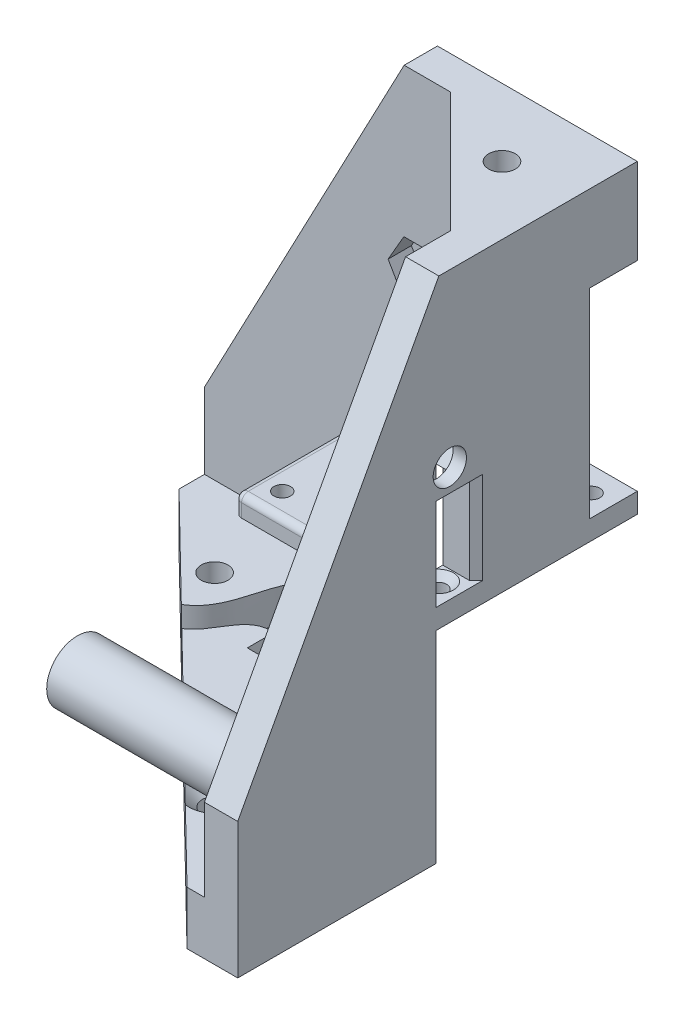
from build123d import *

# Parameters (mm, degrees)
SKETCH1_R                      = 2
BOSS_EXTRUDE1_DEPTH            = 8
BOSS_EXTRUDE3_START            = -8
BOSS_EXTRUDE3_DEPTH            = 76.2
CUT_EXTRUDE1_REACH             = 91.001
SKETCH4_W                      = 29.21
SKETCH4_H                      = 29.21
CUT_EXTRUDE1_DIRECTION_2_DEPTH = 22.3
CUT_EXTRUDE2_START             = -3
SKETCH5_W                      = 6.21
SKETCH5_H                      = 5
SKETCH5_W_2                    = 5
SKETCH5_H_2                    = 6.21
CUT_EXTRUDE2_DEPTH             = 30
CUT_EXTRUDE3_REACH             = 75.326
SKETCH6_R                      = 1.25
CHAMFER1_SIZE                  = 1
CUT_EXTRUDE4_REACH             = 102.097
CUT_EXTRUDE5_REACH             = 106.467
SKETCH9_R                      = 1.25
BOSS_EXTRUDE4_DEPTH            = 3
FILLET2_R                      = 1
SKETCH10_R                     = 11.5
CUT_EXTRUDE6_DEPTH             = 3
SKETCH12_R                     = 4.6
SKETCH12_R_2                   = 2.6
BOSS_EXTRUDE5_DEPTH            = 30
FILLET3_R                      = 1
CHAMFER2_SIZE                  = 1
BOSS_EXTRUDE6_REACH            = 109.184
SKETCH14_W                     = 12.395863616
SKETCH14_H                     = 18.726756054
SKETCH13_R                     = 2.5
CUT_EXTRUDE7_DEPTH             = 20
CUT_EXTRUDE8_DEPTH             = 3
CUT_EXTRUDE11_DEPTH            = 8
BOSS_EXTRUDE8_DEPTH            = 3
BOSS_EXTRUDE9_REACH            = 104.929
SKETCH21_W                     = 7
SKETCH21_H                     = 16.762218259
SKETCH21_R                     = 2.5
SKETCH23_R                     = 2.5
CUT_EXTRUDE12_DEPTH            = 10
CUT_EXTRUDE13_DEPTH            = 3.5
CUT_EXTRUDE14_DEPTH            = 96.269973119
CHAMFER3_SIZE                  = 2
SKETCH26_R                     = 2
BOSS_EXTRUDE10_DEPTH           = 7
CUT_EXTRUDE15_START            = -3.5
SKETCH27_R                     = 2
CUT_EXTRUDE15_DEPTH            = 3.5


with BuildPart() as part:
    # Sketch1 → Boss-Extrude1 (new body)
    with BuildSketch(Plane(origin=(0, 0, 0), x_dir=(1, 0, 0), z_dir=(0, 1, 0))):
        Polygon((-34.466315789, 14.371052632), (-34.466315789, 5.547894737), (17.913684211, -45.628947368), (25.533684211, -45.628947368), (25.533684211, 14.371052632), align=None)
        with Locations(Location((7.652084211, -31.069547368, 0), (0, 0, 270))):
            Circle(SKETCH1_R, mode=Mode.SUBTRACT)
        with Locations(Location((-20.922915789, -2.646947368, 0), (0, 0, 270))):
            Circle(SKETCH1_R, mode=Mode.SUBTRACT)
    extrude(amount=BOSS_EXTRUDE1_DEPTH)

    # Sketch3 → Boss-Extrude3 (add)
    with BuildSketch(Plane(origin=(0, 8, 0), x_dir=(1, 0, 0), z_dir=(0, 1, 0)).offset(BOSS_EXTRUDE3_START)):
        Polygon((-34.466315789, 14.371052632), (-34.466315789, 9.371052632), (20.533684211, 9.371052632), (20.533684211, -45.628947368), (25.533684211, -45.628947368), (25.533684211, 14.371052632), align=None)
    extrude(amount=BOSS_EXTRUDE3_DEPTH)

    # Sketch4 → Cut-Extrude1 (cut, up to next)
    with BuildSketch(Plane(origin=(0, 8, 0), x_dir=(1, 0, 0), z_dir=(0, 1, 0)), mode=Mode.PRIVATE) as cut_extrude1_sk1:
        with Locations((10.928684211, -0.233947368)):
            Rectangle(SKETCH4_W, SKETCH4_H)
    cut_extrude1_tool1 = extrude(cut_extrude1_sk1.sketch, amount=-CUT_EXTRUDE1_REACH, mode=Mode.PRIVATE) & part.part
    add(cut_extrude1_tool1.solids().sort_by_distance((10.928684, 8, 0.233947))[0], mode=Mode.SUBTRACT)

    # Sketch4 → Cut-Extrude1 direction 2 (cut)
    with BuildSketch(Plane(origin=(0, 8, 0), x_dir=(1, 0, 0), z_dir=(0, 1, 0))):
        with Locations((10.928684211, -0.233947368)):
            Rectangle(SKETCH4_W, SKETCH4_H)
    extrude(amount=CUT_EXTRUDE1_DIRECTION_2_DEPTH, mode=Mode.SUBTRACT)

    # Sketch5 → Cut-Extrude2 (cut)
    with BuildSketch(Plane.XZ.offset(-30.3).offset(CUT_EXTRUDE2_START)):
        with Locations((22.428684211, 12.338947368)):
            Rectangle(SKETCH5_W, SKETCH5_H)
        with Locations((-1.176315789, -11.266052632)):
            Rectangle(SKETCH5_W_2, SKETCH5_H_2)
        with Locations((22.428684211, -11.266052632)):
            Rectangle(SKETCH5_W, SKETCH5_H_2)
    extrude(amount=-CUT_EXTRUDE2_DEPTH, mode=Mode.SUBTRACT)

    # Sketch6 → Cut-Extrude3 (cut, up to next)
    with BuildSketch(Plane.XZ.offset(-30.3), mode=Mode.PRIVATE) as cut_extrude3_sk1:
        with Locations(Location((22.323684211, 12.288947368, 0), (0, 0, 270))):
            Circle(SKETCH6_R)
    cut_extrude3_tool1 = extrude(cut_extrude3_sk1.sketch, amount=-CUT_EXTRUDE3_REACH, mode=Mode.PRIVATE) & part.part
    # Sketch6 → Cut-Extrude3 (cut, up to next)
    with BuildSketch(Plane.XZ.offset(-30.3), mode=Mode.PRIVATE) as cut_extrude3_sk2:
        with Locations(Location((22.323684211, -10.711052632, 0), (0, 0, 270))):
            Circle(SKETCH6_R)
    cut_extrude3_tool2 = extrude(cut_extrude3_sk2.sketch, amount=-CUT_EXTRUDE3_REACH, mode=Mode.PRIVATE) & part.part
    # Sketch6 → Cut-Extrude3 (cut, up to next)
    with BuildSketch(Plane.XZ.offset(-30.3), mode=Mode.PRIVATE) as cut_extrude3_sk3:
        with Locations(Location((-0.676315789, -10.711052632, 0), (0, 0, 270))):
            Circle(SKETCH6_R)
    cut_extrude3_tool3 = extrude(cut_extrude3_sk3.sketch, amount=-CUT_EXTRUDE3_REACH, mode=Mode.PRIVATE) & part.part
    add(cut_extrude3_tool1.solids().sort_by_distance((22.323684, 30.3, 12.288947))[0], mode=Mode.SUBTRACT)
    add(cut_extrude3_tool2.solids().sort_by_distance((22.323684, 30.3, -10.711053))[0], mode=Mode.SUBTRACT)
    add(cut_extrude3_tool3.solids().sort_by_distance((-0.676316, 30.3, -10.711053))[0], mode=Mode.SUBTRACT)

    # Chamfer1
    chamfer1_edges = [part.edges().sort_by_distance(p)[0] for p in [
        (19.323684211, 48.3, -14.371052632),
        (25.533684211, 48.3, -8.161052632),
        (-3.676315789, 48.3, -14.371052632),
        (1.323684211, 48.3, -14.371052632),
        (25.533684211, 15.15, 14.838947368),
        (-3.676315789, 15.15, -14.371052632),
        (25.533684211, 48.3, 9.838947368),
        (25.533684211, 48.3, 14.838947368),
    ]]
    chamfer(chamfer1_edges, length=CHAMFER1_SIZE)

    # Sketch7 → Cut-Extrude4 (cut, up to next)
    with BuildSketch(Plane.XY.offset(-9.371052632), mode=Mode.PRIVATE) as cut_extrude4_sk1:
        Polygon((-4.478138481, 76.2), (-34.466315789, 19.345490892), (-34.466315789, 76.2), align=None)
    cut_extrude4_tool1 = extrude(cut_extrude4_sk1.sketch, amount=-CUT_EXTRUDE4_REACH, mode=Mode.PRIVATE) & part.part
    add(cut_extrude4_tool1.solids().sort_by_distance((-24.470257, 57.248497, -9.371053))[0], mode=Mode.SUBTRACT)

    # Sketch8 → Cut-Extrude5 (cut, up to next)
    with BuildSketch(Plane.ZY.offset(-20.533684211), mode=Mode.PRIVATE) as cut_extrude5_sk1:
        Polygon((45.628947368, 76.2), (15.432121686, 76.2), (45.628947368, 20.360875822), align=None)
    cut_extrude5_tool1 = extrude(cut_extrude5_sk1.sketch, amount=-CUT_EXTRUDE5_REACH, mode=Mode.PRIVATE) & part.part
    add(cut_extrude5_tool1.solids().sort_by_distance((20.533684, 57.586959, 35.563339))[0], mode=Mode.SUBTRACT)

    # Sketch9 → Boss-Extrude4 (add)
    with BuildSketch(Plane.XZ.offset(-30.3)):
        with BuildLine():
            Line((-4.676315789, 15.838947368), (-4.676315789, -14.371052632))
            Line((-4.676315789, -14.371052632), (0.900761385, -14.371052632))
            ThreePointArc((0.900761385, -14.371052632), (0.366362818, -13.109171958), (-0.102099011, -11.821356685))
            ThreePointArc((-0.102099011, -11.821356685), (-1.878735883, -11.052645838), (-0.771600032, -9.464689557))
            ThreePointArc((-0.771600032, -9.464689557), (-1.228222209, 0.185593043), (1.804207587, 9.358423992))
            ThreePointArc((1.804207587, 9.358423992), (11.255772005, 12.427491579), (21.173303455, 11.799944181))
            ThreePointArc((21.173303455, 11.799944181), (22.678913505, 13.487409779), (23.021780943, 11.252047686))
            ThreePointArc((23.021780943, 11.252047686), (24.290349599, 10.788966069), (25.533684211, 10.261870194))
            Line((25.533684211, 10.261870194), (25.533684211, 15.838947368))
            Line((25.533684211, 15.838947368), (-4.676315789, 15.838947368))
        make_face()
        with Locations(Location((-1.126315789, 12.288947368, 0), (0, 0, 270))):
            Circle(SKETCH9_R, mode=Mode.SUBTRACT)
    extrude(amount=-BOSS_EXTRUDE4_DEPTH)

    # Fillet2
    fillet2_edges = [part.edges().sort_by_distance(p)[0] for p in [
        (7.928684211, 33.3, 15.838947368),
        (-4.676315789, 33.3, 3.233947368),
        (-4.676315789, 31.8, 15.838947368),
        (-0.793400855, 31.8, -9.371052632),
    ]]
    fillet(fillet2_edges, radius=FILLET2_R)

    # Sketch10 → Cut-Extrude6 (cut)
    with BuildSketch(Plane.XZ.offset(-30.3)):
        with Locations((10.823684211, 0.788947368)):
            Circle(SKETCH10_R)
    extrude(amount=-CUT_EXTRUDE6_DEPTH, mode=Mode.SUBTRACT)

    # Sketch12 → Boss-Extrude5 (add)
    with BuildSketch(Plane.ZY.offset(-20.533684211)):
        with Locations(Location((34.718947368, 16.95, 0), (0, 0, 180))):
            Circle(SKETCH12_R)
        with Locations((34.718947368, 16.95)):
            Circle(SKETCH12_R_2, mode=Mode.SUBTRACT)
    extrude(amount=BOSS_EXTRUDE5_DEPTH)

    # Fillet3
    fillet3_edges = [part.edges().sort_by_distance(p)[0] for p in [
        (-9.466315789, 16.95, 32.118947368),
    ]]
    fillet(fillet3_edges, radius=FILLET3_R)

    # Chamfer2
    # the kernel refuses this chamfer: 1 mm, written as the material it takes off along each edge
    with BuildSketch(Plane(origin=(22.323684211, 33.3, 12.288947368), x_dir=(-0.9203046044214335, 0, -0.3912025499414705), z_dir=(0.3912025499414705, 0, -0.9203046044214335))) as chamfer2_piece_1:
        Polygon((1.25 + CHAMFER2_SIZE, 0), (1.25, -CHAMFER2_SIZE), (1.25, 0), align=None)
    revolve(axis=Axis((22.323684211, 33.3, 12.288947368), (0, 1, 0)), revolution_arc=259.078782156, mode=Mode.SUBTRACT)
    with BuildSketch(Plane(origin=(-0.676315789, 33.3, -10.711052632), x_dir=(0, 0, -1), z_dir=(-1, 0, 0))) as chamfer2_piece_2_section:
        Polygon((1.25 + CHAMFER2_SIZE, 0), (1.25, CHAMFER2_SIZE), (1.25, 0), align=None)
    chamfer2_piece_2 = revolve(axis=Axis((-0.676315789, 33.3, -10.711052632), (0, -1, 0)), mode=Mode.PRIVATE)
    chamfer2_piece_2 = split(chamfer2_piece_2, bisect_by=Plane(origin=(1.323684211, 32.812414485, -8.973467116), z_dir=(-1, 0, 0)), keep=Keep.TOP, mode=Mode.PRIVATE)
    add(chamfer2_piece_2, mode=Mode.SUBTRACT)
    with BuildSketch(Plane(origin=(22.323684211, 33.3, 12.288947368), x_dir=(-0.920304604421433, 0, -0.39120254994147174), z_dir=(-0.39120254994147174, 0, 0.920304604421433))) as chamfer2_piece_3:
        Polygon((1.25 + CHAMFER2_SIZE, 0), (1.25, CHAMFER2_SIZE), (1.25, 0), align=None)
    revolve(axis=Axis((22.323684211, 33.3, 12.288947368), (0, -1, 0)), revolution_arc=66.970653716, mode=Mode.SUBTRACT)
    with BuildSketch(Plane(origin=(22.323684211, 33.3, 12.288947368), x_dir=(0, 0, -1), z_dir=(-1, 0, 0))) as chamfer2_piece_4:
        Polygon((1.25 + CHAMFER2_SIZE, 0), (1.25, CHAMFER2_SIZE), (1.25, 0), align=None)
    revolve(axis=Axis((22.323684211, 33.3, 12.288947368), (0, -1, 0)), revolution_arc=33.950564129, mode=Mode.SUBTRACT)

    # Boss-Extrude6: up to this face of the body (flat: up to its plane)
    boss_extrude6_end = Plane(part.part.faces().sort_by_distance((20.533684211, 42.270087773, 15.731926293))[0])
    # Sketch14 → Boss-Extrude6 (add, up to the picked face)
    with BuildSketch(Plane(origin=(25.533684211, 0, 0), x_dir=(0, 0, -1), z_dir=(1, 0, 0)), mode=Mode.PRIVATE) as boss_extrude6_sk1:
        with Locations((-13.255996287, 56.485629394)):
            Rectangle(SKETCH14_W, SKETCH14_H)
    boss_extrude6_tool1 = split(extrude(boss_extrude6_sk1.sketch, amount=-BOSS_EXTRUDE6_REACH, mode=Mode.PRIVATE), bisect_by=boss_extrude6_end, keep=Keep.BOTH, mode=Mode.PRIVATE)
    add(boss_extrude6_tool1.solids().sort_by(Axis((25.533684, 56.485629, 13.255996), (-1, 0, 0)))[0])

    # Sketch13 → Cut-Extrude7 (cut)
    with BuildSketch(Plane(origin=(25.533684211, 0, 0), x_dir=(0, 0, -1), z_dir=(1, 0, 0))):
        with Locations((-13.782947368, 50.506)):
            Circle(SKETCH13_R)
    extrude(amount=-CUT_EXTRUDE7_DEPTH, mode=Mode.SUBTRACT)

    # Sketch15 → Cut-Extrude8 (cut)
    with BuildSketch(Plane.ZY.offset(-20.533684211)):
        Polygon((16.150083472, 46.406), (18.517219576, 50.506), (16.150083472, 54.606), (11.415811265, 54.606), (9.048675161, 50.506), (11.415811265, 46.406), align=None)
    extrude(amount=-CUT_EXTRUDE8_DEPTH, mode=Mode.SUBTRACT)

    # Sketch19 → Cut-Extrude11 (cut)
    with BuildSketch(Plane(origin=(0, 8, 0), x_dir=(1, 0, 0), z_dir=(0, 1, 0))):
        Polygon((-3.676315789, 2.857670413), (-3.676315789, 7.517950593), (-8.676315789, 7.517950593), (-8.676315789, 5.124778841), (-8.676315789, -5.990338695), (-8.676315789, -9.982049407), (-3.676315789, -9.982049407), align=None)
        with BuildLine():
            Line((-8.676315789, -5.990338695), (-8.676315789, 5.124778841))
            add(Edge.make_bspline(
                [(-8.676315789, 5.124778841), (-16.808569573, 3.725426293), (-13.469663804, -5.736672492), (-19.282893487, -9.286767458)],
                knots=[0, 0, 0, 0, 1, 1, 1, 1], degree=3))
            Line((-19.282893487, -9.286767458), (-16.121145543, -12.375890698))
            add(Edge.make_bspline(
                [(-8.676315789, -5.990338695), (-12.90644661, -5.58199058), (-13.157452533, -10.60956316), (-16.121145543, -12.375890698)],
                knots=[0, 0, 0, 0, 1, 1, 1, 1], degree=3))
        make_face()
    extrude(amount=-CUT_EXTRUDE11_DEPTH, mode=Mode.SUBTRACT)

    # Sketch20 → Boss-Extrude8 (add)
    with BuildSketch(Plane.XZ):
        with BuildLine():
            add(Edge.make_bspline(
                [(-16.121145543, 12.375890698), (-14.069186941, 11.152946562), (-13.317608867, 8.366659728), (-11.645404629, 6.903612087)],
                knots=[0, 0, 0, 0, 0.692365436, 0.692365436, 0.692365436, 0.692365436], degree=3))
            Line((-16.121145543, 12.375890698), (-19.282893487, 9.286767458))
            add(Edge.make_bspline(
                [(-13.371318098, -2.196913004), (-15.640126217, 1.283314512), (-15.162227429, 6.77030817), (-19.282893487, 9.286767458)],
                knots=[0.291157191, 0.291157191, 0.291157191, 0.291157191, 1, 1, 1, 1], degree=3))
            Line((-13.371318098, -2.196913004), (-11.645404629, 6.903612087))
        make_face()
    extrude(amount=-BOSS_EXTRUDE8_DEPTH)

    # Boss-Extrude9: up to this face of the body (flat: up to its plane)
    boss_extrude9_end = Plane(part.part.faces().sort_by_distance((-5.026986126, 41.536172568, -9.371052632))[0])
    # Sketch21 → Boss-Extrude9 (add, up to the picked face)
    with BuildSketch(Plane(origin=(0, 0, -14.371052632), x_dir=(-1, 0, 0), z_dir=(0, 0, -1)), mode=Mode.PRIVATE) as boss_extrude9_sk1:
        with Locations((1.176315789, 54.918890871)):
            Rectangle(SKETCH21_W, SKETCH21_H)
        with Locations((2.152315789, 49.784)):
            Circle(SKETCH21_R, mode=Mode.SUBTRACT)
    boss_extrude9_tool1 = split(extrude(boss_extrude9_sk1.sketch, amount=-BOSS_EXTRUDE9_REACH, mode=Mode.PRIVATE), bisect_by=boss_extrude9_end, keep=Keep.BOTH, mode=Mode.PRIVATE)
    # Sketch21 → Boss-Extrude9 (add, up to the picked face)
    with BuildSketch(Plane(origin=(0, 0, -14.371052632), x_dir=(-1, 0, 0), z_dir=(0, 0, -1)), mode=Mode.PRIVATE) as boss_extrude9_sk2:
        Polygon((5.2501104, 67.18326152), (-3.516242543, 67.18326152), (-3.516242543, 46.537781741), (-2.323684211, 46.537781741), (-2.323684211, 63.3), (4.676315789, 63.3), (4.676315789, 46.537781741), (5.2501104, 46.537781741), align=None)
    boss_extrude9_tool2 = split(extrude(boss_extrude9_sk2.sketch, amount=-BOSS_EXTRUDE9_REACH, mode=Mode.PRIVATE), bisect_by=boss_extrude9_end, keep=Keep.BOTH, mode=Mode.PRIVATE)
    add(boss_extrude9_tool1.solids().sort_by(Axis((-0.980168, 55.950854, -14.371053), (0, 0, 1)))[0])
    add(boss_extrude9_tool2.solids().sort_by(Axis((-4.963213, 46.762077, -14.371053), (0, 0, 1)))[0])

    # Sketch23 → Cut-Extrude12 (cut)
    with BuildSketch(Plane(origin=(0, 0, -14.371052632), x_dir=(-1, 0, 0), z_dir=(0, 0, -1))):
        with Locations((2.152315789, 49.784)):
            Circle(SKETCH23_R)
    extrude(amount=-CUT_EXTRUDE12_DEPTH, mode=Mode.SUBTRACT)

    # Sketch24 → Cut-Extrude13 (cut)
    with BuildSketch(Plane.XY.offset(-9.371052632)):
        Polygon((0.214820314, 45.684), (2.581956418, 49.784), (0.214820314, 53.884), (-4.519451893, 53.884), (-6.886587997, 49.784), (-4.519451893, 45.684), align=None)
    extrude(amount=-CUT_EXTRUDE13_DEPTH, mode=Mode.SUBTRACT)

    # Sketch25 → Cut-Extrude14 (cut, through all)
    with BuildSketch(Plane.XZ):
        with BuildLine():
            Line((5.754378816, 31.700985595), (9.549789605, 31.700985595))
            ThreePointArc((9.549789605, 31.700985595), (7.652084211, 29.069547368), (5.754378816, 31.700985595))
        make_face()
    extrude(amount=-CUT_EXTRUDE14_DEPTH, mode=Mode.SUBTRACT)

    # Chamfer3
    # the kernel refuses this chamfer: 2 mm, written as the material it takes off along each edge
    with BuildSketch(Plane(origin=(7.652084211, 8, 31.069547368), x_dir=(0, 0, 1), z_dir=(-1, 0, 0))) as chamfer3_piece_1:
        Polygon((2 + CHAMFER3_SIZE, 0), (2, -CHAMFER3_SIZE), (2, 0), align=None)
    revolve(axis=Axis((7.652084211, 8, 31.069547368), (0, 1, 0)), revolution_arc=71.595768534, mode=Mode.SUBTRACT)
    with BuildSketch(Plane(origin=(7.652084211, 8, 31.069547368), x_dir=(-0.9488526974220068, 0, 0.315719113445768), z_dir=(-0.315719113445768, 0, -0.9488526974220068))) as chamfer3_piece_2:
        Polygon((2 + CHAMFER3_SIZE, 0), (2, -CHAMFER3_SIZE), (2, 0), align=None)
    revolve(axis=Axis((7.652084211, 8, 31.069547368), (0, 1, 0)), revolution_arc=71.595768534, mode=Mode.SUBTRACT)
    with BuildSketch(Plane(origin=(7.652084211, 8, 31.069547368), x_dir=(0.9488526974220067, 0, 0.3157191134457681), z_dir=(-0.3157191134457681, 0, 0.9488526974220067))) as chamfer3_piece_3:
        Polygon((2 + CHAMFER3_SIZE, 0), (2, -CHAMFER3_SIZE), (2, 0), align=None)
    revolve(axis=Axis((7.652084211, 8, 31.069547368), (0, 1, 0)), revolution_arc=216.808462933, mode=Mode.SUBTRACT)

    # Sketch26 → Boss-Extrude10 (add)
    with BuildSketch(Plane(origin=(0, 76.2, 0), x_dir=(1, 0, 0), z_dir=(0, 1, 0))):
        Polygon((25.533684211, 14.371052632), (-2.539314398, 14.371052632), (25.533684211, -13.701945977), align=None)
        with Locations(Location((15.373684211, 4.211052632, 0), (0, 0, 270))):
            Circle(SKETCH26_R, mode=Mode.SUBTRACT)
    extrude(amount=-BOSS_EXTRUDE10_DEPTH)

    # Sketch27 → Cut-Extrude15 (cut)
    with BuildSketch(Plane.XZ.offset(-69.2).offset(CUT_EXTRUDE15_START)):
        Polygon((17.394410153, -0.711052632), (13.352958268, -0.711052632), (11.332232326, -4.211052632), (13.352958268, -7.711052632), (17.394410153, -7.711052632), (19.415136095, -4.211052632), align=None)
        with Locations(Location((15.373684211, -4.211052632, 0), (0, 0, 90))):
            Circle(SKETCH27_R, mode=Mode.SUBTRACT)
    extrude(amount=CUT_EXTRUDE15_DEPTH, mode=Mode.SUBTRACT)


solid = part.part
